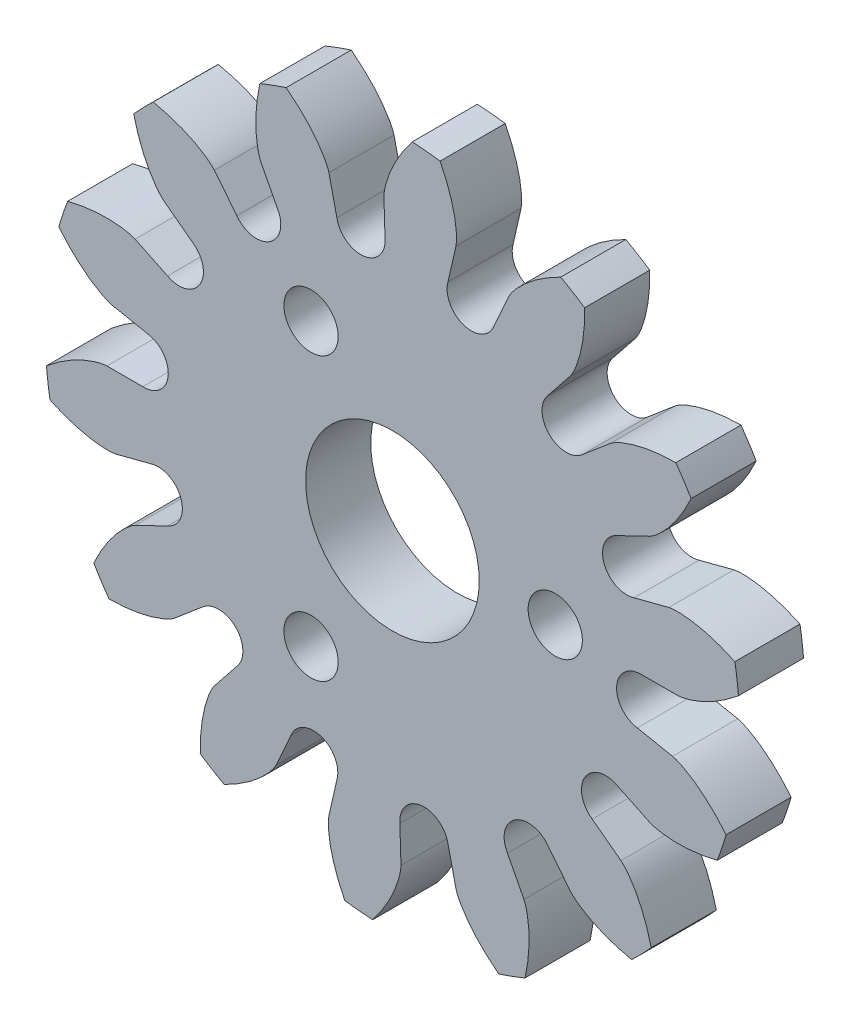
from build123d import *

# Parameters (mm, degrees)
SKETCH_1_R               = 16
EXTRUDE_1_DEPTH          = 1.5
CUT_EXTRUDE_1_DEPTH      = 23.825424421
PATTERN_CIRCULAR_4_COUNT = 14
MIRROR_1_COPY_1_DEPTH    = 23.825424421
MIRROR_1_COPY_2_DEPTH    = 23.825424421
MIRROR_1_COPY_3_DEPTH    = 23.825424421
MIRROR_1_COPY_4_DEPTH    = 23.825424421
MIRROR_1_COPY_5_DEPTH    = 23.825424421
MIRROR_1_COPY_6_DEPTH    = 23.825424421
MIRROR_1_COPY_7_DEPTH    = 23.825424421
MIRROR_1_COPY_8_DEPTH    = 23.825424421
MIRROR_1_COPY_9_DEPTH    = 23.825424421
MIRROR_1_COPY_10_DEPTH   = 23.825424421
MIRROR_1_COPY_11_DEPTH   = 23.825424421
MIRROR_1_COPY_12_DEPTH   = 23.825424421
MIRROR_1_COPY_13_DEPTH   = 23.825424421
SKETCH_5_R               = 4
CUT_EXTRUDE_3_DEPTH      = 23.765113242
HOLE_WIZARD_M3_1_D       = 2.5
PATTERN_CIRCULAR_6_COUNT = 3
SKETCH_8_R               = 1.118502379
CUT_EXTRUDE_4_DEPTH      = 23.765113242


with BuildPart() as part:
    # ｽｹｯﾁ1 → ﾎﾞｽ - 押し出し1 (new, symmetric)
    with BuildSketch(Plane.XY):
        Circle(SKETCH_1_R)
    extrude(amount=EXTRUDE_1_DEPTH, both=True)

    # ｽｹｯﾁ3 → ｶｯﾄ - 押し出し1 (cut, through all)
    with BuildSketch(Plane.XY.offset(1.5)):
        with BuildLine():
            Line((11.5, 0), (13.155696691, 0))
            add(Edge.make_bspline(
                [(13.155696691, 0), (13.19624559, 0.001761212), (13.309510044, 0.012073236), (13.522904262, 0.053193293), (13.862331338, 0.149977029), (14.287773817, 0.318536793), (14.812678366, 0.58351972), (15.296302568, 0.889178357), (15.646846139, 1.147837894), (15.872968174, 1.330487148), (15.939860895, 1.385941793)],
                knots=[0, 0, 0, 0, 0, 0.005604071, 0.015718253, 0.029959921, 0.048733673, 0.068727069, 0.096888899, 0.108897771, 0.108897771, 0.108897771, 0.108897771, 0.108897771], degree=4))
            ThreePointArc((15.939860895, 1.385941793), (15.999776576, -0.084554807), (15.924322264, -1.554336009))
            Line((15.924322264, -1.554336009), (11.445606627, -1.117179007))
            ThreePointArc((11.445606627, -1.117179007), (11.486393608, -0.55925119), (11.5, 0))
        make_face()
    cut_extrude_1 = extrude(amount=-CUT_EXTRUDE_1_DEPTH, mode=Mode.SUBTRACT)

    # 円形ﾊﾟﾀｰﾝ4: ｶｯﾄ - 押し出し1 ×14 about axis
    pattern_circular_4_axis = Axis((0, 0, 1.5), (0, 0, -1))
    for i in range(1, PATTERN_CIRCULAR_4_COUNT):
        add(cut_extrude_1.rotate(pattern_circular_4_axis, i * 360 / PATTERN_CIRCULAR_4_COUNT), mode=Mode.SUBTRACT)

    # ﾐﾗｰ1: ｶｯﾄ - 押し出し1 across plane
    add(cut_extrude_1.mirror(Plane(origin=(11.445606627, -1.117179007, -1.5), x_dir=(0, 0, 1), z_dir=(-0.09714600058804714, -0.9952701415041784, 0))), mode=Mode.SUBTRACT)

    # ﾐﾗｰ1 copy 1 sketch → ﾐﾗｰ1 copy 1 (cut, through all)
    with BuildSketch(Plane(origin=(0, 0, 1.5), x_dir=(0.9678647712635922, 0.25147123999947685, 0), z_dir=(0, 0, 1))):
        with BuildLine():
            Line((11.5, 0), (13.155696691, 0))
            add(Edge.make_bspline(
                [(13.155696691, 0), (13.19624559, -0.001761212), (13.309510044, -0.012073236), (13.522904262, -0.053193293), (13.862331338, -0.149977029), (14.287773817, -0.318536793), (14.812678366, -0.58351972), (15.296302568, -0.889178357), (15.646846139, -1.147837894), (15.872968174, -1.330487148), (15.939860895, -1.385941793)],
                knots=[0, 0, 0, 0, 0, 0.005604071, 0.015718253, 0.029959921, 0.048733673, 0.068727069, 0.096888899, 0.108897771, 0.108897771, 0.108897771, 0.108897771, 0.108897771], degree=4))
            ThreePointArc((15.939860895, -1.385941793), (15.999776576, 0.084554807), (15.924322264, 1.554336009))
            Line((15.924322264, 1.554336009), (11.445606627, 1.117179007))
            ThreePointArc((11.445606627, 1.117179007), (11.486393608, 0.55925119), (11.5, 0))
        make_face()
    extrude(amount=-MIRROR_1_COPY_1_DEPTH, mode=Mode.SUBTRACT)

    # ﾐﾗｰ1 copy 2 sketch → ﾐﾗｰ1 copy 2 (cut, through all)
    with BuildSketch(Plane(origin=(0, 0, 1.5), x_dir=(0.7629067453564907, 0.6465085443283538, 0), z_dir=(0, 0, 1))):
        with BuildLine():
            Line((11.5, 0), (13.155696691, 0))
            add(Edge.make_bspline(
                [(13.155696691, 0), (13.19624559, -0.001761212), (13.309510044, -0.012073236), (13.522904262, -0.053193293), (13.862331338, -0.149977029), (14.287773817, -0.318536793), (14.812678366, -0.58351972), (15.296302568, -0.889178357), (15.646846139, -1.147837894), (15.872968174, -1.330487148), (15.939860895, -1.385941793)],
                knots=[0, 0, 0, 0, 0, 0.005604071, 0.015718253, 0.029959921, 0.048733673, 0.068727069, 0.096888899, 0.108897771, 0.108897771, 0.108897771, 0.108897771, 0.108897771], degree=4))
            ThreePointArc((15.939860895, -1.385941793), (15.999776576, 0.084554807), (15.924322264, 1.554336009))
            Line((15.924322264, 1.554336009), (11.445606627, 1.117179007))
            ThreePointArc((11.445606627, 1.117179007), (11.486393608, 0.55925119), (11.5, 0))
        make_face()
    extrude(amount=-MIRROR_1_COPY_2_DEPTH, mode=Mode.SUBTRACT)

    # ﾐﾗｰ1 copy 3 sketch → ﾐﾗｰ1 copy 3 (cut, through all)
    with BuildSketch(Plane(origin=(0, 0, 1.5), x_dir=(0.4068456820943209, 0.9134969025460388, 0), z_dir=(0, 0, 1))):
        with BuildLine():
            Line((11.5, 0), (13.155696691, 0))
            add(Edge.make_bspline(
                [(13.155696691, 0), (13.19624559, -0.001761212), (13.309510044, -0.012073236), (13.522904262, -0.053193293), (13.862331338, -0.149977029), (14.287773817, -0.318536793), (14.812678366, -0.58351972), (15.296302568, -0.889178357), (15.646846139, -1.147837894), (15.872968174, -1.330487148), (15.939860895, -1.385941793)],
                knots=[0, 0, 0, 0, 0, 0.005604071, 0.015718253, 0.029959921, 0.048733673, 0.068727069, 0.096888899, 0.108897771, 0.108897771, 0.108897771, 0.108897771, 0.108897771], degree=4))
            ThreePointArc((15.939860895, -1.385941793), (15.999776576, 0.084554807), (15.924322264, 1.554336009))
            Line((15.924322264, 1.554336009), (11.445606627, 1.117179007))
            ThreePointArc((11.445606627, 1.117179007), (11.486393608, 0.55925119), (11.5, 0))
        make_face()
    extrude(amount=-MIRROR_1_COPY_3_DEPTH, mode=Mode.SUBTRACT)

    # ﾐﾗｰ1 copy 4 sketch → ﾐﾗｰ1 copy 4 (cut, through all)
    with BuildSketch(Plane(origin=(0, 0, 1.5), x_dir=(-0.029796158141474988, 0.9995559959101884, 0), z_dir=(0, 0, 1))):
        with BuildLine():
            Line((11.5, 0), (13.155696691, 0))
            add(Edge.make_bspline(
                [(13.155696691, 0), (13.19624559, -0.001761212), (13.309510044, -0.012073236), (13.522904262, -0.053193293), (13.862331338, -0.149977029), (14.287773817, -0.318536793), (14.812678366, -0.58351972), (15.296302568, -0.889178357), (15.646846139, -1.147837894), (15.872968174, -1.330487148), (15.939860895, -1.385941793)],
                knots=[0, 0, 0, 0, 0, 0.005604071, 0.015718253, 0.029959921, 0.048733673, 0.068727069, 0.096888899, 0.108897771, 0.108897771, 0.108897771, 0.108897771, 0.108897771], degree=4))
            ThreePointArc((15.939860895, -1.385941793), (15.999776576, 0.084554807), (15.924322264, 1.554336009))
            Line((15.924322264, 1.554336009), (11.445606627, 1.117179007))
            ThreePointArc((11.445606627, 1.117179007), (11.486393608, 0.55925119), (11.5, 0))
        make_face()
    extrude(amount=-MIRROR_1_COPY_4_DEPTH, mode=Mode.SUBTRACT)

    # ﾐﾗｰ1 copy 5 sketch → ﾐﾗｰ1 copy 5 (cut, through all)
    with BuildSketch(Plane(origin=(0, 0, 1.5), x_dir=(-0.46053650383145367, 0.8876407655345161, 0), z_dir=(0, 0, 1))):
        with BuildLine():
            Line((11.5, 0), (13.155696691, 0))
            add(Edge.make_bspline(
                [(13.155696691, 0), (13.19624559, -0.001761212), (13.309510044, -0.012073236), (13.522904262, -0.053193293), (13.862331338, -0.149977029), (14.287773817, -0.318536793), (14.812678366, -0.58351972), (15.296302568, -0.889178357), (15.646846139, -1.147837894), (15.872968174, -1.330487148), (15.939860895, -1.385941793)],
                knots=[0, 0, 0, 0, 0, 0.005604071, 0.015718253, 0.029959921, 0.048733673, 0.068727069, 0.096888899, 0.108897771, 0.108897771, 0.108897771, 0.108897771, 0.108897771], degree=4))
            ThreePointArc((15.939860895, -1.385941793), (15.999776576, 0.084554807), (15.924322264, 1.554336009))
            Line((15.924322264, 1.554336009), (11.445606627, 1.117179007))
            ThreePointArc((11.445606627, 1.117179007), (11.486393608, 0.55925119), (11.5, 0))
        make_face()
    extrude(amount=-MIRROR_1_COPY_5_DEPTH, mode=Mode.SUBTRACT)

    # ﾐﾗｰ1 copy 6 sketch → ﾐﾗｰ1 copy 6 (cut, through all)
    with BuildSketch(Plane(origin=(0, 0, 1.5), x_dir=(-0.80006194682805, 0.5999173953451512, 0), z_dir=(0, 0, 1))):
        with BuildLine():
            Line((11.5, 0), (13.155696691, 0))
            add(Edge.make_bspline(
                [(13.155696691, 0), (13.19624559, -0.001761212), (13.309510044, -0.012073236), (13.522904262, -0.053193293), (13.862331338, -0.149977029), (14.287773817, -0.318536793), (14.812678366, -0.58351972), (15.296302568, -0.889178357), (15.646846139, -1.147837894), (15.872968174, -1.330487148), (15.939860895, -1.385941793)],
                knots=[0, 0, 0, 0, 0, 0.005604071, 0.015718253, 0.029959921, 0.048733673, 0.068727069, 0.096888899, 0.108897771, 0.108897771, 0.108897771, 0.108897771, 0.108897771], degree=4))
            ThreePointArc((15.939860895, -1.385941793), (15.999776576, 0.084554807), (15.924322264, 1.554336009))
            Line((15.924322264, 1.554336009), (11.445606627, 1.117179007))
            ThreePointArc((11.445606627, 1.117179007), (11.486393608, 0.55925119), (11.5, 0))
        make_face()
    extrude(amount=-MIRROR_1_COPY_6_DEPTH, mode=Mode.SUBTRACT)

    # ﾐﾗｰ1 copy 7 sketch → ﾐﾗｰ1 copy 7 (cut, through all)
    with BuildSketch(Plane(origin=(0, 0, 1.5), x_dir=(-0.9811253091394943, 0.19337302750366145, 0), z_dir=(0, 0, 1))):
        with BuildLine():
            Line((11.5, 0), (13.155696691, 0))
            add(Edge.make_bspline(
                [(13.155696691, 0), (13.19624559, -0.001761212), (13.309510044, -0.012073236), (13.522904262, -0.053193293), (13.862331338, -0.149977029), (14.287773817, -0.318536793), (14.812678366, -0.58351972), (15.296302568, -0.889178357), (15.646846139, -1.147837894), (15.872968174, -1.330487148), (15.939860895, -1.385941793)],
                knots=[0, 0, 0, 0, 0, 0.005604071, 0.015718253, 0.029959921, 0.048733673, 0.068727069, 0.096888899, 0.108897771, 0.108897771, 0.108897771, 0.108897771, 0.108897771], degree=4))
            ThreePointArc((15.939860895, -1.385941793), (15.999776576, 0.084554807), (15.924322264, 1.554336009))
            Line((15.924322264, 1.554336009), (11.445606627, 1.117179007))
            ThreePointArc((11.445606627, 1.117179007), (11.486393608, 0.55925119), (11.5, 0))
        make_face()
    extrude(amount=-MIRROR_1_COPY_7_DEPTH, mode=Mode.SUBTRACT)

    # ﾐﾗｰ1 copy 8 sketch → ﾐﾗｰ1 copy 8 (cut, through all)
    with BuildSketch(Plane(origin=(0, 0, 1.5), x_dir=(-0.967864771263592, -0.25147123999947674, 0), z_dir=(0, 0, 1))):
        with BuildLine():
            Line((11.5, 0), (13.155696691, 0))
            add(Edge.make_bspline(
                [(13.155696691, 0), (13.19624559, -0.001761212), (13.309510044, -0.012073236), (13.522904262, -0.053193293), (13.862331338, -0.149977029), (14.287773817, -0.318536793), (14.812678366, -0.58351972), (15.296302568, -0.889178357), (15.646846139, -1.147837894), (15.872968174, -1.330487148), (15.939860895, -1.385941793)],
                knots=[0, 0, 0, 0, 0, 0.005604071, 0.015718253, 0.029959921, 0.048733673, 0.068727069, 0.096888899, 0.108897771, 0.108897771, 0.108897771, 0.108897771, 0.108897771], degree=4))
            ThreePointArc((15.939860895, -1.385941793), (15.999776576, 0.084554807), (15.924322264, 1.554336009))
            Line((15.924322264, 1.554336009), (11.445606627, 1.117179007))
            ThreePointArc((11.445606627, 1.117179007), (11.486393608, 0.55925119), (11.5, 0))
        make_face()
    extrude(amount=-MIRROR_1_COPY_8_DEPTH, mode=Mode.SUBTRACT)

    # ﾐﾗｰ1 copy 9 sketch → ﾐﾗｰ1 copy 9 (cut, through all)
    with BuildSketch(Plane(origin=(0, 0, 1.5), x_dir=(-0.7629067453564908, -0.6465085443283536, 0), z_dir=(0, 0, 1))):
        with BuildLine():
            Line((11.5, 0), (13.155696691, 0))
            add(Edge.make_bspline(
                [(13.155696691, 0), (13.19624559, -0.001761212), (13.309510044, -0.012073236), (13.522904262, -0.053193293), (13.862331338, -0.149977029), (14.287773817, -0.318536793), (14.812678366, -0.58351972), (15.296302568, -0.889178357), (15.646846139, -1.147837894), (15.872968174, -1.330487148), (15.939860895, -1.385941793)],
                knots=[0, 0, 0, 0, 0, 0.005604071, 0.015718253, 0.029959921, 0.048733673, 0.068727069, 0.096888899, 0.108897771, 0.108897771, 0.108897771, 0.108897771, 0.108897771], degree=4))
            ThreePointArc((15.939860895, -1.385941793), (15.999776576, 0.084554807), (15.924322264, 1.554336009))
            Line((15.924322264, 1.554336009), (11.445606627, 1.117179007))
            ThreePointArc((11.445606627, 1.117179007), (11.486393608, 0.55925119), (11.5, 0))
        make_face()
    extrude(amount=-MIRROR_1_COPY_9_DEPTH, mode=Mode.SUBTRACT)

    # ﾐﾗｰ1 copy 10 sketch → ﾐﾗｰ1 copy 10 (cut, through all)
    with BuildSketch(Plane(origin=(0, 0, 1.5), x_dir=(-0.40684568209432015, -0.913496902546039, 0), z_dir=(0, 0, 1))):
        with BuildLine():
            Line((11.5, 0), (13.155696691, 0))
            add(Edge.make_bspline(
                [(13.155696691, 0), (13.19624559, -0.001761212), (13.309510044, -0.012073236), (13.522904262, -0.053193293), (13.862331338, -0.149977029), (14.287773817, -0.318536793), (14.812678366, -0.58351972), (15.296302568, -0.889178357), (15.646846139, -1.147837894), (15.872968174, -1.330487148), (15.939860895, -1.385941793)],
                knots=[0, 0, 0, 0, 0, 0.005604071, 0.015718253, 0.029959921, 0.048733673, 0.068727069, 0.096888899, 0.108897771, 0.108897771, 0.108897771, 0.108897771, 0.108897771], degree=4))
            ThreePointArc((15.939860895, -1.385941793), (15.999776576, 0.084554807), (15.924322264, 1.554336009))
            Line((15.924322264, 1.554336009), (11.445606627, 1.117179007))
            ThreePointArc((11.445606627, 1.117179007), (11.486393608, 0.55925119), (11.5, 0))
        make_face()
    extrude(amount=-MIRROR_1_COPY_10_DEPTH, mode=Mode.SUBTRACT)

    # ﾐﾗｰ1 copy 11 sketch → ﾐﾗｰ1 copy 11 (cut, through all)
    with BuildSketch(Plane(origin=(0, 0, 1.5), x_dir=(0.029796158141475737, -0.9995559959101883, 0), z_dir=(0, 0, 1))):
        with BuildLine():
            Line((11.5, 0), (13.155696691, 0))
            add(Edge.make_bspline(
                [(13.155696691, 0), (13.19624559, -0.001761212), (13.309510044, -0.012073236), (13.522904262, -0.053193293), (13.862331338, -0.149977029), (14.287773817, -0.318536793), (14.812678366, -0.58351972), (15.296302568, -0.889178357), (15.646846139, -1.147837894), (15.872968174, -1.330487148), (15.939860895, -1.385941793)],
                knots=[0, 0, 0, 0, 0, 0.005604071, 0.015718253, 0.029959921, 0.048733673, 0.068727069, 0.096888899, 0.108897771, 0.108897771, 0.108897771, 0.108897771, 0.108897771], degree=4))
            ThreePointArc((15.939860895, -1.385941793), (15.999776576, 0.084554807), (15.924322264, 1.554336009))
            Line((15.924322264, 1.554336009), (11.445606627, 1.117179007))
            ThreePointArc((11.445606627, 1.117179007), (11.486393608, 0.55925119), (11.5, 0))
        make_face()
    extrude(amount=-MIRROR_1_COPY_11_DEPTH, mode=Mode.SUBTRACT)

    # ﾐﾗｰ1 copy 12 sketch → ﾐﾗｰ1 copy 12 (cut, through all)
    with BuildSketch(Plane(origin=(0, 0, 1.5), x_dir=(0.46053650383145317, -0.8876407655345163, 0), z_dir=(0, 0, 1))):
        with BuildLine():
            Line((11.5, 0), (13.155696691, 0))
            add(Edge.make_bspline(
                [(13.155696691, 0), (13.19624559, -0.001761212), (13.309510044, -0.012073236), (13.522904262, -0.053193293), (13.862331338, -0.149977029), (14.287773817, -0.318536793), (14.812678366, -0.58351972), (15.296302568, -0.889178357), (15.646846139, -1.147837894), (15.872968174, -1.330487148), (15.939860895, -1.385941793)],
                knots=[0, 0, 0, 0, 0, 0.005604071, 0.015718253, 0.029959921, 0.048733673, 0.068727069, 0.096888899, 0.108897771, 0.108897771, 0.108897771, 0.108897771, 0.108897771], degree=4))
            ThreePointArc((15.939860895, -1.385941793), (15.999776576, 0.084554807), (15.924322264, 1.554336009))
            Line((15.924322264, 1.554336009), (11.445606627, 1.117179007))
            ThreePointArc((11.445606627, 1.117179007), (11.486393608, 0.55925119), (11.5, 0))
        make_face()
    extrude(amount=-MIRROR_1_COPY_12_DEPTH, mode=Mode.SUBTRACT)

    # ﾐﾗｰ1 copy 13 sketch → ﾐﾗｰ1 copy 13 (cut, through all)
    with BuildSketch(Plane(origin=(0, 0, 1.5), x_dir=(0.80006194682805, -0.5999173953451513, 0), z_dir=(0, 0, 1))):
        with BuildLine():
            Line((11.5, 0), (13.155696691, 0))
            add(Edge.make_bspline(
                [(13.155696691, 0), (13.19624559, -0.001761212), (13.309510044, -0.012073236), (13.522904262, -0.053193293), (13.862331338, -0.149977029), (14.287773817, -0.318536793), (14.812678366, -0.58351972), (15.296302568, -0.889178357), (15.646846139, -1.147837894), (15.872968174, -1.330487148), (15.939860895, -1.385941793)],
                knots=[0, 0, 0, 0, 0, 0.005604071, 0.015718253, 0.029959921, 0.048733673, 0.068727069, 0.096888899, 0.108897771, 0.108897771, 0.108897771, 0.108897771, 0.108897771], degree=4))
            ThreePointArc((15.939860895, -1.385941793), (15.999776576, 0.084554807), (15.924322264, 1.554336009))
            Line((15.924322264, 1.554336009), (11.445606627, 1.117179007))
            ThreePointArc((11.445606627, 1.117179007), (11.486393608, 0.55925119), (11.5, 0))
        make_face()
    extrude(amount=-MIRROR_1_COPY_13_DEPTH, mode=Mode.SUBTRACT)

    # ｽｹｯﾁ5 → ｶｯﾄ - 押し出し3 (cut, through all)
    with BuildSketch(Plane.XY.offset(1.5)):
        Circle(SKETCH_5_R)
    extrude(amount=-CUT_EXTRUDE_3_DEPTH, mode=Mode.SUBTRACT)

    # M3 ねじ穴1 (through all)
    with Locations(Plane.XY.offset(1.5)):
        with Locations((7.5, 0)):
            hole_wizard_m3_1 = Hole(HOLE_WIZARD_M3_1_D / 2)

    # 円形ﾊﾟﾀｰﾝ6: M3 ねじ穴1 ×3 about axis
    pattern_circular_6_axis = Axis((0, 0, -1.5), (0, 0, 1))
    for i in range(1, PATTERN_CIRCULAR_6_COUNT):
        add(hole_wizard_m3_1.rotate(pattern_circular_6_axis, i * 360 / PATTERN_CIRCULAR_6_COUNT), mode=Mode.SUBTRACT)

    # ｽｹｯﾁ8 → ｶｯﾄ - 押し出し4 (cut, through all)
    with BuildSketch(Plane.XY.offset(1.5)):
        with Locations((3.636056073, 10.910045657)):
            Circle(SKETCH_8_R)
        with Locations((8.009664727, 8.25198588)):
            Circle(SKETCH_8_R)
        with Locations((10.79686105, 3.959519095)):
            Circle(SKETCH_8_R)
        with Locations((11.445606627, -1.117179007)):
            Circle(SKETCH_8_R)
        with Locations((9.827409441, -5.972606105)):
            Circle(SKETCH_8_R)
        with Locations((6.262773289, -9.645085315)):
            Circle(SKETCH_8_R)
        with Locations((1.45771808, -11.407237089)):
            Circle(SKETCH_8_R)
        with Locations((-3.636056073, -10.910045657)):
            Circle(SKETCH_8_R)
        with Locations((-8.009664727, -8.25198588)):
            Circle(SKETCH_8_R)
        with Locations((-10.79686105, -3.959519095)):
            Circle(SKETCH_8_R)
        with Locations((-11.445606627, 1.117179007)):
            Circle(SKETCH_8_R)
        with Locations((-9.827409441, 5.972606105)):
            Circle(SKETCH_8_R)
        with Locations((-6.262773289, 9.645085315)):
            Circle(SKETCH_8_R)
        with Locations((-1.45771808, 11.407237089)):
            Circle(SKETCH_8_R)
    extrude(amount=-CUT_EXTRUDE_4_DEPTH, mode=Mode.SUBTRACT)


solid = part.part
